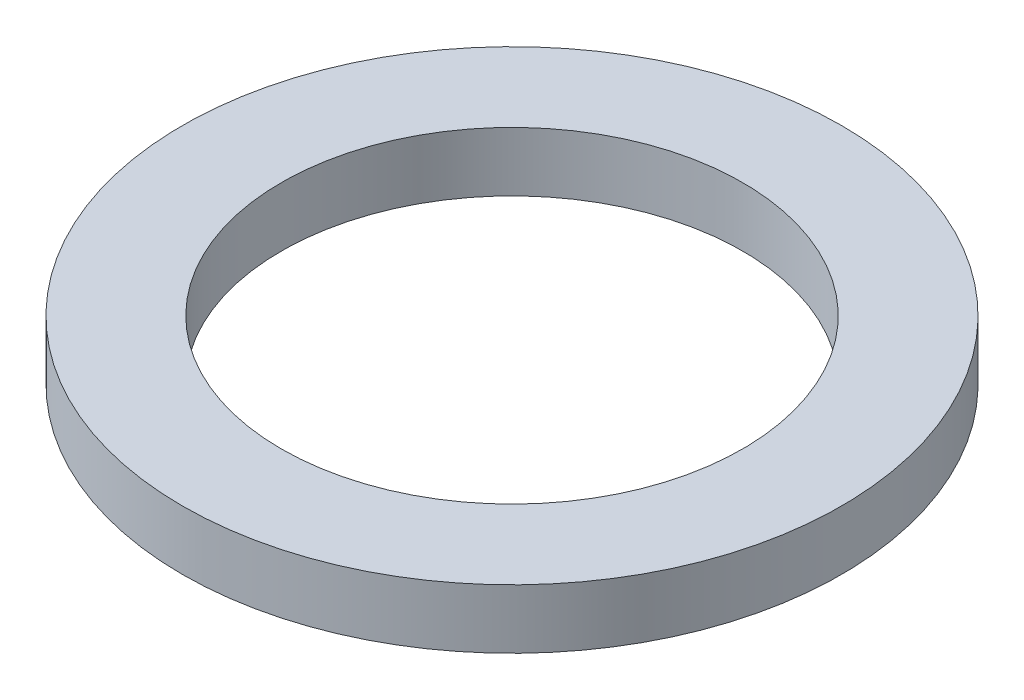
from build123d import *

# Parameters (mm, degrees)
SKETCH1_R           = 50
BOSS_EXTRUDE1_DEPTH = 9
SKETCH2_R           = 35
CUT_EXTRUDE1_DEPTH  = 72.281133549


with BuildPart() as part:
    # Sketch1 → Boss-Extrude1 (new body)
    with BuildSketch(Plane(origin=(0, 0, 0), x_dir=(1, 0, 0), z_dir=(0, 1, 0))):
        Circle(SKETCH1_R)
    extrude(amount=BOSS_EXTRUDE1_DEPTH)

    # Sketch2 → Cut-Extrude1 (cut, through all)
    with BuildSketch(Plane(origin=(0, 0, 0), x_dir=(1, 0, 0), z_dir=(0, 1, 0))):
        Circle(SKETCH2_R)
    extrude(amount=CUT_EXTRUDE1_DEPTH, mode=Mode.SUBTRACT)


solid = part.part
